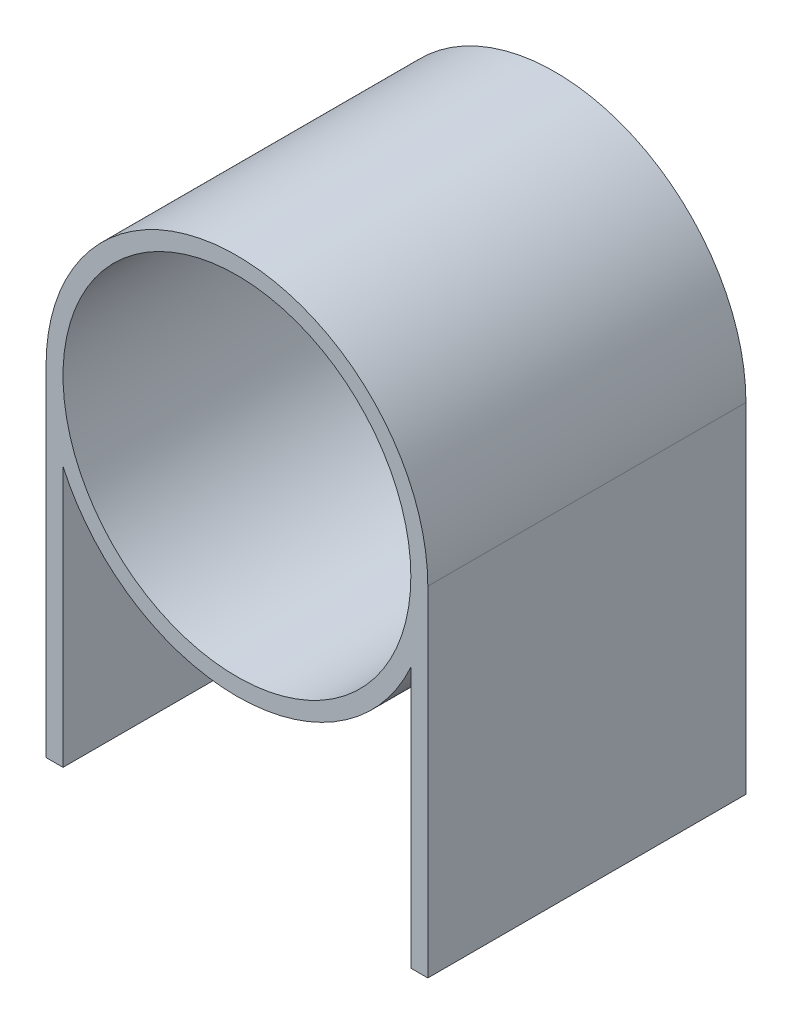
from build123d import *

# Parameters (mm, degrees)
BOSS_EXTRUDE1_DEPTH            = 30
CUT_EXTRUDE1_DEPTH             = 27
SKETCH4_R                      = 0.75
CUT_EXTRUDE2_DEPTH             = 46.57411546
SKETCH5_W                      = 5
SKETCH5_H                      = 2
BOSS_EXTRUDE2_DEPTH            = 4
SHELL1_START                   = 1.6
SHELL1_DEPTH                   = 26.8
CUT_EXTRUDE3_REACH             = 49.413
CUT_EXTRUDE3_DIRECTION_2_DEPTH = 48.413078365


# Read off the part's stored shape, not the designer's step: Shell1
with BuildPart() as part:
    # Sketch2 → Boss-Extrude1 (new body)
    with BuildSketch(Plane.XY):
        with BuildLine():
            Line((-18, 0), (-18, -32))
            Line((-18, -32), (18, -32))
            Line((18, -32), (18, 0))
            ThreePointArc((18, 0), (0, 18), (-18, 0))
        make_face()
    extrude(amount=BOSS_EXTRUDE1_DEPTH)

    # Sketch3 → Cut-Extrude1 (cut)
    with BuildSketch(Plane.XY.offset(30)):
        with BuildLine():
            ThreePointArc((-16.4, 0), (0, -16.4), (16.4, 0))
            ThreePointArc((16.4, 0), (0, 16.4), (-16.4, 0))
        make_face()
    extrude(amount=-CUT_EXTRUDE1_DEPTH, mode=Mode.SUBTRACT)

    # Sketch4 → Cut-Extrude2 (cut, through all)
    with BuildSketch(Plane.XY.offset(3)):
        with Locations((-1.27, 0)):
            Circle(SKETCH4_R)
        with Locations((1.27, 0)):
            Circle(SKETCH4_R)
    extrude(amount=-CUT_EXTRUDE2_DEPTH, mode=Mode.SUBTRACT)

    # Sketch5 → Boss-Extrude2 (add)
    with BuildSketch(Plane.XY.offset(3)):
        with Locations((0, -2.475)):
            Rectangle(SKETCH5_W, SKETCH5_H)
    extrude(amount=BOSS_EXTRUDE2_DEPTH)

    # Shell1 outline → Shell1 (cut)
    with BuildSketch(Plane.XY.offset(SHELL1_START)):
        with BuildLine():
            ThreePointArc((16.4, -7.418894796), (0, -18), (-16.4, -7.418894796))
            Line((-16.4, -7.418894796), (-16.4, -32))
            Line((-16.4, -32), (16.4, -32))
            Line((16.4, -32), (16.4, -7.418894796))
        make_face()
    extrude(amount=SHELL1_DEPTH, mode=Mode.SUBTRACT)

    # Sketch6 → Cut-Extrude3 (cut, up to next)
    with BuildSketch(Plane.XY.offset(30), mode=Mode.PRIVATE) as cut_extrude3_sk1:
        with BuildLine():
            Line((-16.4, -32), (16.4, -32))
            Line((16.4, -32), (16.4, -7.418894796))
            ThreePointArc((16.4, -7.418894796), (0, -18), (-16.4, -7.418894796))
            Line((-16.4, -7.418894796), (-16.4, -32))
        make_face()
    cut_extrude3_tool1 = extrude(cut_extrude3_sk1.sketch, amount=-CUT_EXTRUDE3_REACH, mode=Mode.PRIVATE) & part.part
    add(cut_extrude3_tool1.solids().sort_by_distance((0, -23.265352, 30))[0], mode=Mode.SUBTRACT)

    # Sketch6 → Cut-Extrude3 direction 2 (cut)
    with BuildSketch(Plane.XY.offset(30)):
        with BuildLine():
            Line((-16.4, -32), (16.4, -32))
            Line((16.4, -32), (16.4, -7.418894796))
            ThreePointArc((16.4, -7.418894796), (0, -18), (-16.4, -7.418894796))
            Line((-16.4, -7.418894796), (-16.4, -32))
        make_face()
    extrude(amount=CUT_EXTRUDE3_DIRECTION_2_DEPTH, mode=Mode.SUBTRACT)


solid = part.part
